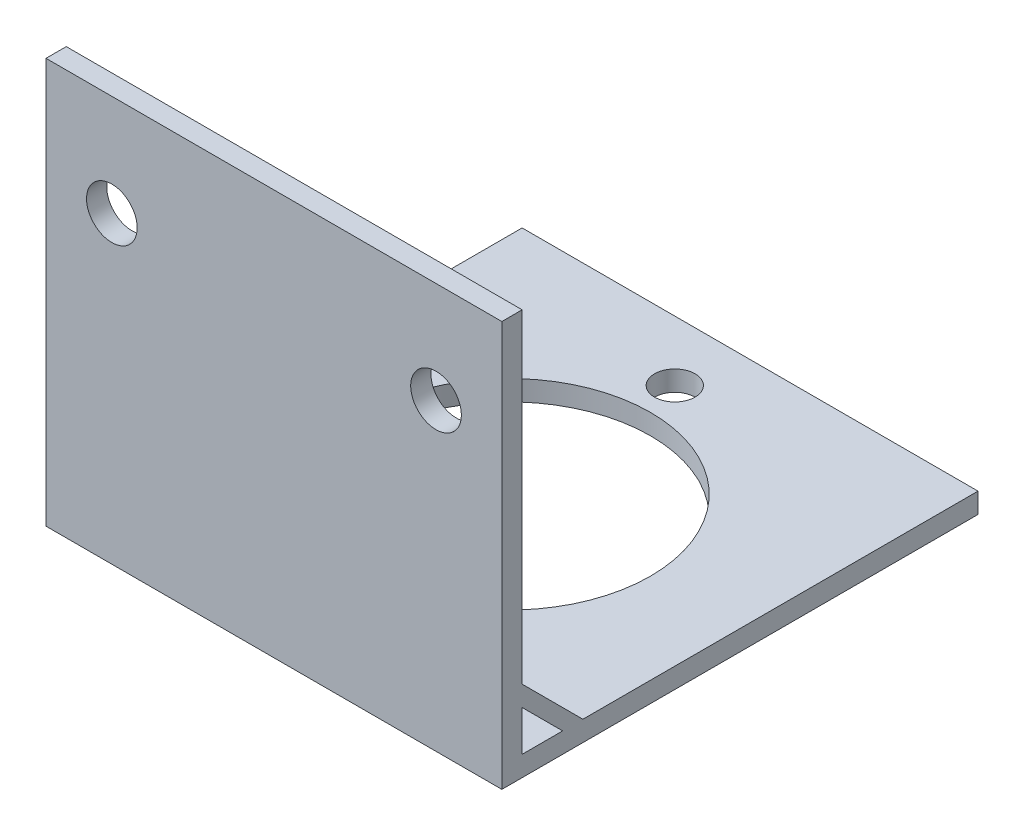
from build123d import *

# Parameters (mm, degrees)
SKETCH7_W           = 45
SKETCH7_H           = 45
SKETCH7_R           = 2
SKETCH7_R_2         = 14
BOSS_EXTRUDE5_DEPTH = 2
SKETCH7_3_W         = 45
SKETCH7_3_H         = 2
BOSS_EXTRUDE6_DEPTH = 40
BOSS_EXTRUDE7_DEPTH = 2
SKETCH10_R          = 2.5
CUT_EXTRUDE2_DEPTH  = 2


with BuildPart() as part:
    # Sketch7 → Boss-Extrude5 (new body)
    with BuildSketch(Plane(origin=(0, 0, 0), x_dir=(1, 0, 0), z_dir=(0, 1, 0))):
        with Locations((5.756289545, -118.050969126)):
            Rectangle(SKETCH7_W, SKETCH7_H)
        with Locations((4.259373978, -136.485312035)):
            Circle(SKETCH7_R, mode=Mode.SUBTRACT)
        with Locations((5.362034713, -118.985312035)):
            Circle(SKETCH7_R_2, mode=Mode.SUBTRACT)
        with Locations((4.259373978, -101.485312035)):
            Circle(SKETCH7_R, mode=Mode.SUBTRACT)
    extrude(amount=BOSS_EXTRUDE5_DEPTH)

    # Sketch7<3> → Boss-Extrude6 (add)
    with BuildSketch(Plane(origin=(0, 0, 0), x_dir=(1, 0, 0), z_dir=(0, 1, 0))):
        with Locations((5.756289545, -141.550969126)):
            Rectangle(SKETCH7_3_W, SKETCH7_3_H)
    extrude(amount=BOSS_EXTRUDE6_DEPTH)

    # Sketch8 → Boss-Extrude7 (add)
    with BuildSketch(Plane.ZY.offset(16.743710455)):
        Polygon((140.550969126, 6), (136.550969126, 2), (134.550969126, 2), (140.550969126, 8), align=None)
    boss_extrude7 = extrude(amount=-BOSS_EXTRUDE7_DEPTH)

    # Mirror2: Boss-Extrude7 across plane
    add(boss_extrude7.mirror(Plane.ZY.offset(-5.756289545)))

    # Sketch10 → Cut-Extrude2 (cut)
    with BuildSketch(Plane.XY.offset(142.550969126)):
        with Locations((21.756289545, 30)):
            Circle(SKETCH10_R)
        with Locations((-10.243710455, 30)):
            Circle(SKETCH10_R)
    extrude(amount=-CUT_EXTRUDE2_DEPTH, mode=Mode.SUBTRACT)


solid = part.part
